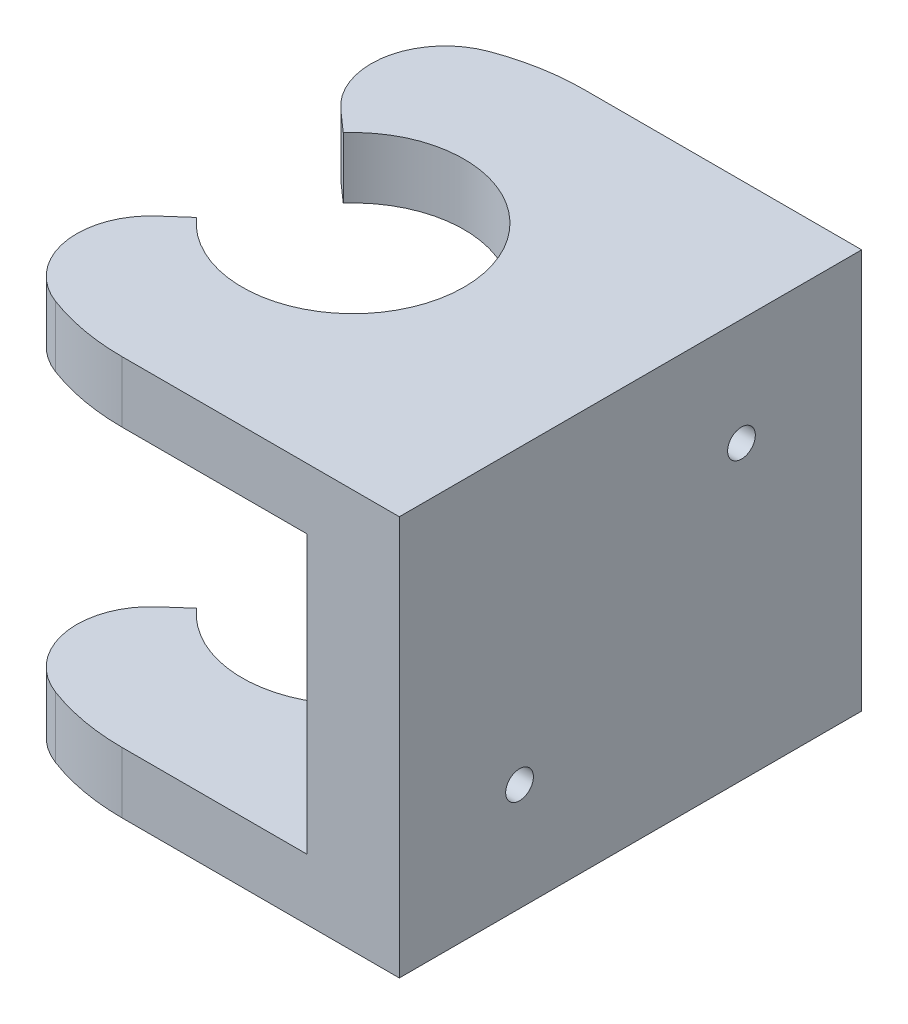
from build123d import *

# Parameters (mm, degrees)
BOSS_EXTRUDE1_DEPTH = 3.3
SKETCH3_W           = 5
SKETCH3_H           = 25
BOSS_EXTRUDE3_DEPTH = 15
BOSS_EXTRUDE4_DEPTH = 3.3
SKETCH5_R           = 0.75
CUT_EXTRUDE1_DEPTH  = 35.884819406
FILLET1_R           = 4


with BuildPart() as part:
    # Sketch2 → Boss-Extrude1 (new body)
    with BuildSketch(Plane(origin=(0, 0, 0), x_dir=(1, 0, 0), z_dir=(0, 1, 0))):
        with BuildLine():
            Line((15, -12.5), (15, 12.5))
            Line((15, 12.5), (0, 12.5))
            ThreePointArc((0, 12.5), (-5.142972847, 11.392972847), (-9.375, 8.267972847))
            Line((-9.375, 8.267972847), (-4.5, 3.968626967))
            ThreePointArc((-4.5, 3.968626967), (6, 0), (-4.5, -3.968626967))
            Line((-4.5, -3.968626967), (-9.375, -8.267972847))
            ThreePointArc((-9.375, -8.267972847), (-5.142972847, -11.392972847), (0, -12.5))
            Line((0, -12.5), (15, -12.5))
        make_face()
    extrude(amount=BOSS_EXTRUDE1_DEPTH)

    # Sketch3 → Boss-Extrude3 (add)
    with BuildSketch(Plane(origin=(0, 3.3, 0), x_dir=(1, 0, 0), z_dir=(0, 1, 0))):
        with Locations((12.5, 0)):
            Rectangle(SKETCH3_W, SKETCH3_H)
    extrude(amount=BOSS_EXTRUDE3_DEPTH)

    # Sketch4 → Boss-Extrude4 (add)
    with BuildSketch(Plane(origin=(0, 18.3, 0), x_dir=(1, 0, 0), z_dir=(0, 1, 0))):
        with BuildLine():
            Line((15, -12.5), (15, 12.5))
            Line((15, 12.5), (0, 12.5))
            ThreePointArc((0, 12.5), (-5.142972847, 11.392972847), (-9.375, 8.267972847))
            Line((-9.375, 8.267972847), (-4.5, 3.968626967))
            ThreePointArc((-4.5, 3.968626967), (6, 0), (-4.5, -3.968626967))
            Line((-4.5, -3.968626967), (-9.375, -8.267972847))
            ThreePointArc((-9.375, -8.267972847), (-5.142972847, -11.392972847), (0, -12.5))
            Line((0, -12.5), (15, -12.5))
        make_face()
    extrude(amount=BOSS_EXTRUDE4_DEPTH)

    # Sketch5 → Cut-Extrude1 (cut, through all)
    with BuildSketch(Plane(origin=(15, 0, 0), x_dir=(0, 0, -1), z_dir=(1, 0, 0))):
        with Locations((6, 15.8)):
            Circle(SKETCH5_R)
        with Locations((-6, 5.8)):
            Circle(SKETCH5_R)
    extrude(amount=-CUT_EXTRUDE1_DEPTH, mode=Mode.SUBTRACT)

    # Fillet1
    fillet1_edges = [part.edges().sort_by_distance(p)[0] for p in [
        (-9.375, 1.65, 8.267972847),
        (-9.375, 1.65, -8.267972847),
        (-9.375, 19.95, -8.267972847),
        (-9.375, 19.95, 8.267972847),
    ]]
    fillet(fillet1_edges, radius=FILLET1_R)


solid = part.part
